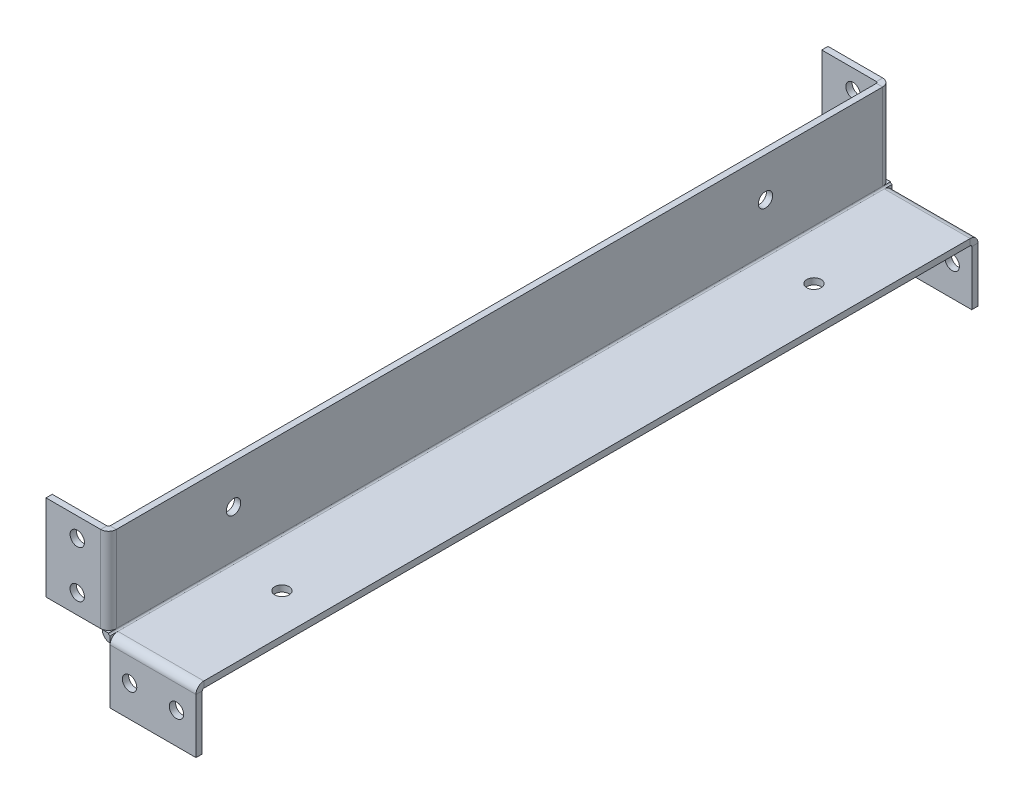
from build123d import *

# Parameters (mm, degrees)
SKETCH1_W                      = 60
SKETCH1_H                      = 500.5
BASE_FLANGE1_DEPTH             = 4
EDGE_FLANGE1_STRIP_W           = 18
EDGE_FLANGE1_STRIP_H           = 4
EDGE_FLANGE1_STRIP_CUT_DEPTH   = 500.5
EDGE_FLANGE1_DEPTH             = 500.5
EDGE_FLANGE2_STRIP_W           = 18
EDGE_FLANGE2_STRIP_H           = 4
EDGE_FLANGE2_STRIP_CUT_DEPTH   = 55
EDGE_FLANGE2_STRIP_2_W         = 18
EDGE_FLANGE2_STRIP_2_H         = 4
EDGE_FLANGE2_STRIP_CUT_2_DEPTH = 55
EDGE_FLANGE2_STRIP_3_W         = 18
EDGE_FLANGE2_STRIP_3_H         = 4
EDGE_FLANGE2_STRIP_CUT_3_DEPTH = 55
EDGE_FLANGE2_STRIP_4_W         = 18
EDGE_FLANGE2_STRIP_4_H         = 4
EDGE_FLANGE2_STRIP_CUT_4_DEPTH = 55
EDGE_FLANGE2_DEPTH             = 55
EDGE_FLANGE2_BEND_DEPTH        = 55
EDGE_FLANGE2_BEND_2_DEPTH      = 55
EDGE_FLANGE2_BEND_3_DEPTH      = 55
SKETCH18_R                     = 4.6
EXTRUDE1_DEPTH                 = 509.385926241
SKETCH19_R                     = 4.6
EXTRUDE2_DEPTH                 = 4
SKETCH20_R                     = 4.6
EXTRUDE3_DEPTH                 = 4


# Sheet-metal steps are written as plain solids
with BuildPart() as part:
    # Sketch1 → Base-Flange1 (new body)
    with BuildSketch(Plane(origin=(0, 0, 0), x_dir=(1, 0, 0), z_dir=(0, 1, 0))):
        Rectangle(SKETCH1_W, SKETCH1_H)
    extrude(amount=BASE_FLANGE1_DEPTH)

    # Edge-Flange1 strip (across the edge) → Edge-Flange1 strip cut (cut)
    with BuildSketch(Plane(origin=(-30, 4, -250.25), x_dir=(1, 0, 0), z_dir=(0, 0, 1))):
        with Locations((-4, -2)):
            Rectangle(EDGE_FLANGE1_STRIP_W, EDGE_FLANGE1_STRIP_H)
    extrude(amount=EDGE_FLANGE1_STRIP_CUT_DEPTH, mode=Mode.SUBTRACT)

    # Edge-Flange1 section (across the edge) → Edge-Flange1 (add)
    with BuildSketch(Plane(origin=(-30, 4, -250.25), x_dir=(1, 0, 0), z_dir=(0, 0, 1))):
        with BuildLine():
            Line((0, 1), (0, 56))
            Line((0, 56), (4, 56))
            Line((4, 56), (4, 1))
            ThreePointArc((4, 1), (4.292893219, 0.292893219), (5, 0))
            Line((5, 0), (5, -4))
            ThreePointArc((5, -4), (1.464466094, -2.535533906), (0, 1))
        make_face()
    extrude(amount=EDGE_FLANGE1_DEPTH)

    # Edge-Flange2 strip (across the edge) → Edge-Flange2 strip cut (cut)
    with BuildSketch(Plane(origin=(-30, 5, 250.25), x_dir=(0, 0, -1), z_dir=(0, 1, 0))):
        with Locations((-4, -2)):
            Rectangle(EDGE_FLANGE2_STRIP_W, EDGE_FLANGE2_STRIP_H)
    extrude(amount=EDGE_FLANGE2_STRIP_CUT_DEPTH, mode=Mode.SUBTRACT)

    # Edge-Flange2 strip 2 (across the edge) → Edge-Flange2 strip cut 2 (cut)
    with BuildSketch(Plane(origin=(30, 0, 250.25), x_dir=(0, 0, -1), z_dir=(-1, 0, 0))):
        with Locations((-4, -2)):
            Rectangle(EDGE_FLANGE2_STRIP_2_W, EDGE_FLANGE2_STRIP_2_H)
    extrude(amount=EDGE_FLANGE2_STRIP_CUT_2_DEPTH, mode=Mode.SUBTRACT)

    # Edge-Flange2 strip 3 (across the edge) → Edge-Flange2 strip cut 3 (cut)
    with BuildSketch(Plane(origin=(-30, 60, -250.25), x_dir=(0, 0, 1), z_dir=(0, -1, 0))):
        with Locations((-4, -2)):
            Rectangle(EDGE_FLANGE2_STRIP_3_W, EDGE_FLANGE2_STRIP_3_H)
    extrude(amount=EDGE_FLANGE2_STRIP_CUT_3_DEPTH, mode=Mode.SUBTRACT)

    # Edge-Flange2 strip 4 (across the edge) → Edge-Flange2 strip cut 4 (cut)
    with BuildSketch(Plane(origin=(-25, 0, -250.25), x_dir=(0, 0, 1), z_dir=(1, 0, 0))):
        with Locations((-4, -2)):
            Rectangle(EDGE_FLANGE2_STRIP_4_W, EDGE_FLANGE2_STRIP_4_H)
    extrude(amount=EDGE_FLANGE2_STRIP_CUT_4_DEPTH, mode=Mode.SUBTRACT)

    # Edge-Flange2 section (across the edge) → Edge-Flange2 (add)
    with BuildSketch(Plane(origin=(-30, 5, 250.25), x_dir=(0, 0, -1), z_dir=(0, 1, 0))):
        with BuildLine():
            Line((0, 1), (0, 36))
            Line((0, 36), (4, 36))
            Line((4, 36), (4, 1))
            ThreePointArc((4, 1), (4.292893219, 0.292893219), (5, 0))
            Line((5, 0), (5, -4))
            ThreePointArc((5, -4), (1.464466094, -2.535533906), (0, 1))
        make_face()
    extrude(amount=EDGE_FLANGE2_DEPTH)

    # Edge-Flange2 section 2 (across the edge) → Edge-Flange2 bend (add)
    with BuildSketch(Plane(origin=(30, 0, 250.25), x_dir=(0, 0, -1), z_dir=(-1, 0, 0))):
        with BuildLine():
            Line((0, 1), (0, 36))
            Line((0, 36), (4, 36))
            Line((4, 36), (4, 1))
            ThreePointArc((4, 1), (4.292893219, 0.292893219), (5, 0))
            Line((5, 0), (5, -4))
            ThreePointArc((5, -4), (1.464466094, -2.535533906), (0, 1))
        make_face()
    extrude(amount=EDGE_FLANGE2_BEND_DEPTH)

    # Edge-Flange2 section 3 (across the edge) → Edge-Flange2 bend 2 (add)
    with BuildSketch(Plane(origin=(-30, 60, -250.25), x_dir=(0, 0, 1), z_dir=(0, -1, 0))):
        with BuildLine():
            Line((0, 1), (0, 36))
            Line((0, 36), (4, 36))
            Line((4, 36), (4, 1))
            ThreePointArc((4, 1), (4.292893219, 0.292893219), (5, 0))
            Line((5, 0), (5, -4))
            ThreePointArc((5, -4), (1.464466094, -2.535533906), (0, 1))
        make_face()
    extrude(amount=EDGE_FLANGE2_BEND_2_DEPTH)

    # Edge-Flange2 section 4 (across the edge) → Edge-Flange2 bend 3 (add)
    with BuildSketch(Plane(origin=(-25, 0, -250.25), x_dir=(0, 0, 1), z_dir=(1, 0, 0))):
        with BuildLine():
            Line((0, 1), (0, 36))
            Line((0, 36), (4, 36))
            Line((4, 36), (4, 1))
            ThreePointArc((4, 1), (4.292893219, 0.292893219), (5, 0))
            Line((5, 0), (5, -4))
            ThreePointArc((5, -4), (1.464466094, -2.535533906), (0, 1))
        make_face()
    extrude(amount=EDGE_FLANGE2_BEND_3_DEPTH)

    # Sketch18 → Extrude1 (cut, through all)
    with BuildSketch(Plane.XY.offset(250.25)):
        with Locations((-46, 47.5)):
            Circle(SKETCH18_R)
        with Locations((-46, 17.5)):
            Circle(SKETCH18_R)
        with Locations((-12.5, -16)):
            Circle(SKETCH18_R)
        with Locations((17.5, -16)):
            Circle(SKETCH18_R)
    extrude(amount=-EXTRUDE1_DEPTH, mode=Mode.SUBTRACT)

    # Sketch19 → Extrude2 (cut)
    with BuildSketch(Plane(origin=(-26, 0, 0), x_dir=(0, 0, -1), z_dir=(1, 0, 0))):
        with Locations(Location((-170.25, 35, 0), (0, 0, 90))):
            Circle(SKETCH19_R)
        with Locations(Location((170.25, 35, 0), (0, 0, 90))):
            Circle(SKETCH19_R)
    extrude(amount=-EXTRUDE2_DEPTH, mode=Mode.SUBTRACT)

    # Sketch20 → Extrude3 (cut)
    with BuildSketch(Plane(origin=(0, 4, 0), x_dir=(1, 0, 0), z_dir=(0, 1, 0))):
        with Locations(Location((5, 170.25, 0), (0, 0, 270))):
            Circle(SKETCH20_R)
        with Locations(Location((5, -170.25, 0), (0, 0, 270))):
            Circle(SKETCH20_R)
    extrude(amount=-EXTRUDE3_DEPTH, mode=Mode.SUBTRACT)


solid = part.part
